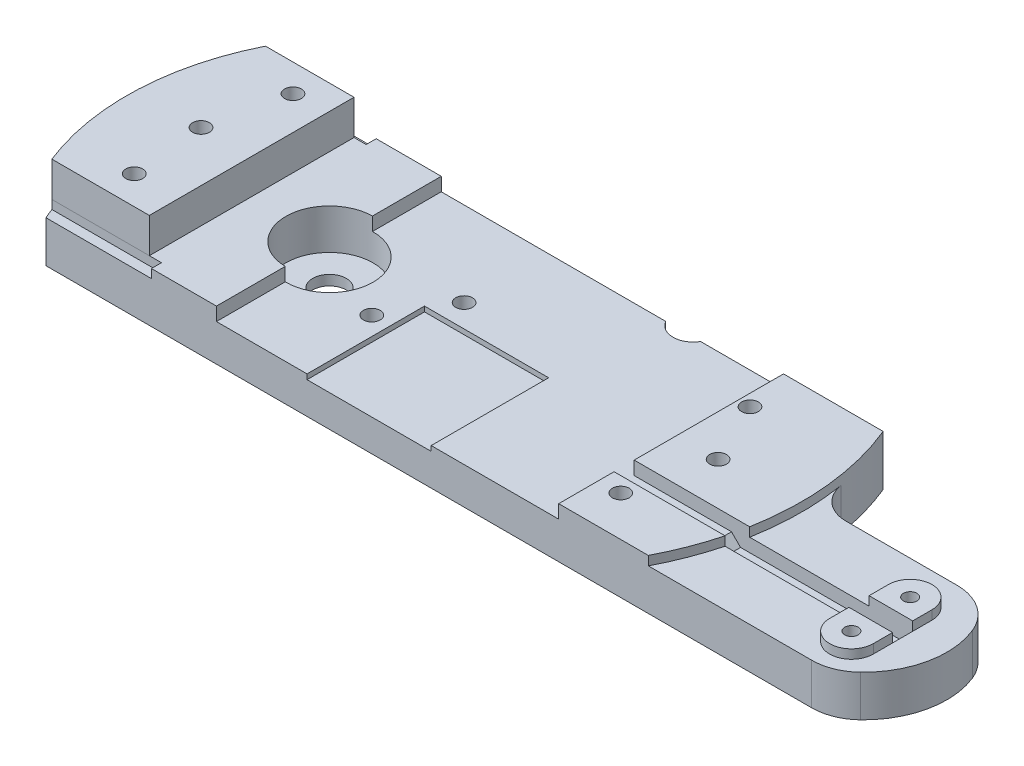
from build123d import *

# Parameters (mm, degrees)
SKETCH1_W           = 195
SKETCH1_H           = 67
BOSS_EXTRUDE1_DEPTH = 25.4
CUT_EXTRUDE1_DEPTH  = 107.177492907
CUT_EXTRUDE2_DEPTH  = 121.997561959
CUT_EXTRUDE3_START  = -13
SKETCH4_W           = 3.612655346
SKETCH4_H           = 3
CUT_EXTRUDE3_DEPTH  = 13
SKETCH6_R           = 2.5
CUT_EXTRUDE4_DEPTH  = 107.177492907
SKETCH7_W           = 37
SKETCH7_H           = 35
CUT_EXTRUDE5_DEPTH  = 1.5
CUT_EXTRUDE6_DEPTH  = 18.5
SKETCH9_R           = 2
BOSS_EXTRUDE2_DEPTH = 12.3
FILLET1_R           = 10
CUT_EXTRUDE7_REACH  = 165.895
CUT_EXTRUDE7_START  = -3
SKETCH10_R          = 13
SKETCH13_R          = 5
CUT_EXTRUDE9_DEPTH  = 161.89488962
SKETCH11_R          = 2
BOSS_EXTRUDE3_DEPTH = 2.7
CUT_EXTRUDE8_DEPTH  = 6


# Read off the part's stored shape, not the designer's step: Split1
with BuildPart() as part:
    # Sketch1 → Boss-Extrude1 (new body)
    with BuildSketch(Plane(origin=(0, 0, 0), x_dir=(1, 0, 0), z_dir=(0, 1, 0))):
        Rectangle(SKETCH1_W, SKETCH1_H)
    extrude(amount=BOSS_EXTRUDE1_DEPTH)

    # Sketch2 → Cut-Extrude1 (cut, through all)
    with BuildSketch(Plane.XZ):
        with BuildLine():
            Line((97.5, -3.219751644), (97.5, 33.5))
            Line((97.5, 33.5), (88.5, 33.5))
            ThreePointArc((88.5, 33.5), (95.217186872, 15.683556008), (97.5, -3.219751644))
        make_face()
        with BuildLine():
            Line((97.5, -33.5), (97.5, -3.219751644))
            ThreePointArc((97.5, -3.219751644), (95.985558513, -18.65423771), (91.5, -33.5))
            Line((91.5, -33.5), (97.5, -33.5))
        make_face()
        with BuildLine():
            ThreePointArc((-88, -33.5), (-95.08607052, -15.861694529), (-97.5, 2.992884749))
            Line((-97.5, 2.992884749), (-97.5, -33.5))
            Line((-97.5, -33.5), (-88, -33.5))
        make_face()
        with BuildLine():
            ThreePointArc((-97.5, 2.992884749), (-95.856964648, 18.588830376), (-91, 33.5))
            Line((-91, 33.5), (-97.5, 33.5))
            Line((-97.5, 33.5), (-97.5, 2.992884749))
        make_face()
    extrude(amount=-CUT_EXTRUDE1_DEPTH, mode=Mode.SUBTRACT)

    # Sketch3 → Cut-Extrude2 (cut, through all)
    with BuildSketch(Plane(origin=(0, 0, 33.5), x_dir=(-1, 0, 0), z_dir=(0, 0, -1))):
        Polygon((63.2, 25.4), (63.2, 15), (40.2, 15), (40.2, 11), (-61.8, 11), (-61.8, 15), (-97.5, 15), (-97.5, 25.4), align=None)
    extrude(amount=CUT_EXTRUDE2_DEPTH, mode=Mode.SUBTRACT)

    # Sketch4 → Cut-Extrude3 (cut)
    with BuildSketch(Plane(origin=(0, 25.4, 0), x_dir=(1, 0, 0), z_dir=(0, 1, 0)).offset(CUT_EXTRUDE3_START)):
        with BuildLine():
            Line((-63.2, 30.5), (-63.2, 33.5))
            Line((-63.2, 33.5), (-88, 33.5))
            ThreePointArc((-88, 33.5), (-88.810680862, 32.008999469), (-89.587344654, 30.5))
            Line((-89.587344654, 30.5), (-63.2, 30.5))
        make_face()
        with Locations((-61.393672327, 32)):
            Rectangle(SKETCH4_W, SKETCH4_H)
        with BuildLine():
            Line((-63.2, -33.5), (-63.2, -30.5))
            Line((-63.2, -30.5), (-92.261692194, -30.5))
            ThreePointArc((-92.261692194, -30.5), (-91.647155152, -32.006859002), (-91, -33.5))
            Line((-91, -33.5), (-63.2, -33.5))
        make_face()
        with Locations((-61.393672327, -32)):
            Rectangle(SKETCH4_W, SKETCH4_H)
    extrude(amount=CUT_EXTRUDE3_DEPTH, mode=Mode.SUBTRACT)

    # Sketch6 → Cut-Extrude4 (cut, through all)
    with BuildSketch(Plane.XZ):
        with Locations(Location((-18.7, 8.7, 0), (0, 0, 270))):
            Circle(SKETCH6_R)
        with Locations(Location((74.1, -1.7, 0), (0, 0, 270))):
            Circle(SKETCH6_R)
        with Locations(Location((68.3, 21.5, 0), (0, 0, 270))):
            Circle(SKETCH6_R)
        with Locations(Location((65.3, -20, 0), (0, 0, 270))):
            Circle(SKETCH6_R)
        with Locations(Location((-8.2, -8.3, 0), (0, 0, 270))):
            Circle(SKETCH6_R)
        with Locations(Location((-76.2, 22, 0), (0, 0, 270))):
            Circle(SKETCH6_R)
        with Locations(Location((-78.2, 0.1, 0), (0, 0, 270))):
            Circle(SKETCH6_R)
        with Locations(Location((-73.2, -22.3, 0), (0, 0, 270))):
            Circle(SKETCH6_R)
    extrude(amount=-CUT_EXTRUDE4_DEPTH, mode=Mode.SUBTRACT)

    # Sketch7 → Cut-Extrude5 (cut)
    with BuildSketch(Plane(origin=(0, 11, 0), x_dir=(1, 0, 0), z_dir=(0, 1, 0))):
        with Locations((5.3, -16)):
            Rectangle(SKETCH7_W, SKETCH7_H)
    extrude(amount=-CUT_EXTRUDE5_DEPTH, mode=Mode.SUBTRACT)

    # Sketch8 → Cut-Extrude6 (cut)
    with BuildSketch(Plane(origin=(0, 25.4, 0), x_dir=(1, 0, 0), z_dir=(0, 1, 0))):
        with BuildLine():
            Line((37.096152423, 33.5), (31.9, 33.5))
            Line((31.9, 33.5), (31.9, 30.5))
            ThreePointArc((31.9, 30.5), (34.9, 31.303847577), (37.096152423, 33.5))
        make_face()
        with BuildLine():
            Line((31.9, 33.5), (26.703847577, 33.5))
            ThreePointArc((26.703847577, 33.5), (28.9, 31.303847577), (31.9, 30.5))
            Line((31.9, 30.5), (31.9, 33.5))
        make_face()
    extrude(amount=-CUT_EXTRUDE6_DEPTH, mode=Mode.SUBTRACT)

    # Sketch9 → Boss-Extrude2 (add)
    with BuildSketch(Plane.XZ):
        with BuildLine():
            Line((88.5, 33.5), (137.200361796, 33.5))
            ThreePointArc((137.200361796, 33.5), (142.769729546, 32.427747228), (147.542861296, 29.364285714))
            ThreePointArc((147.542861296, 29.364285714), (154.743476693, 16.527679502), (153.473750823, 1.864285714))
            ThreePointArc((153.473750823, 1.864285714), (147.953179578, -4.940573023), (139.572717606, -7.5))
            Line((139.572717606, -7.5), (97.384558849, -7.5))
            ThreePointArc((97.384558849, -7.5), (95.698800641, 13.597328658), (88.5, 33.5))
        make_face()
        with Locations(Location((138.3, 5.25, 0), (0, 0, 270))):
            Circle(SKETCH9_R, mode=Mode.SUBTRACT)
        with Locations(Location((138.3, 22.75, 0), (0, 0, 270))):
            Circle(SKETCH9_R, mode=Mode.SUBTRACT)
    extrude(amount=-BOSS_EXTRUDE2_DEPTH)

    # Fillet1
    fillet1_edges = [part.edges().sort_by_distance(p)[0] for p in [
        (97.384558849, 6.15, -7.5),
    ]]
    fillet(fillet1_edges, radius=FILLET1_R)

    # Cut-Extrude7: up to this face of the body (flat: up to its plane)
    cut_extrude7_end = Plane(part.part.faces().sort_by_distance((-51.561702064, 15, 0))[0])
    # Sketch10 → Cut-Extrude7 (cut, up to the picked face)
    with BuildSketch(Plane.XZ.offset(CUT_EXTRUDE7_START), mode=Mode.PRIVATE) as cut_extrude7_sk1:
        with Locations(Location((-40.017782272, 0, 0), (0, 0, 270))):
            Circle(SKETCH10_R)
    cut_extrude7_tool1 = split(extrude(cut_extrude7_sk1.sketch, amount=-CUT_EXTRUDE7_REACH, mode=Mode.PRIVATE), bisect_by=cut_extrude7_end, keep=Keep.BOTH, mode=Mode.PRIVATE)
    add(cut_extrude7_tool1.solids().sort_by(Axis((-40.017782, 3, 0), (0, 1, 0)))[0], mode=Mode.SUBTRACT)

    # Sketch13 → Cut-Extrude9 (cut, through all)
    with BuildSketch(Plane.XZ):
        with Locations(Location((-40.017782272, 0, 0), (0, 0, 270))):
            Circle(SKETCH13_R)
    extrude(amount=-CUT_EXTRUDE9_DEPTH, mode=Mode.SUBTRACT)

    # Sketch11 → Boss-Extrude3 (add)
    # profile 1 of 2: a face of its own
    with BuildSketch(Plane(origin=(0, 12.3, 0), x_dir=(1, 0, 0), z_dir=(0, 1, 0))):
        with BuildLine():
            Line((144.8, -11), (144.8, -5.25))
            ThreePointArc((144.8, -5.25), (138.3, 1.25), (131.8, -5.25))
            Line((131.8, -5.25), (131.8, -11))
            Line((131.8, -11), (144.8, -11))
        make_face()
        with Locations(Location((138.3, -5.25, 0), (0, 0, 90))):
            Circle(SKETCH11_R, mode=Mode.SUBTRACT)
    # profile 2 of 2: a face of its own
    with BuildSketch(Plane(origin=(0, 12.3, 0), x_dir=(1, 0, 0), z_dir=(0, 1, 0))):
        with BuildLine():
            Line((144.8, -22.75), (144.8, -17))
            Line((144.8, -17), (131.8, -17))
            Line((131.8, -17), (131.8, -22.75))
            ThreePointArc((131.8, -22.75), (138.3, -29.25), (144.8, -22.75))
        make_face()
        with Locations(Location((138.3, -22.75, 0), (0, 0, 90))):
            Circle(SKETCH11_R, mode=Mode.SUBTRACT)
    extrude(amount=BOSS_EXTRUDE3_DEPTH)


with BuildPart() as body_2:
    # Split1: the piece on the far side of the plane
    add(part.part)
    split(bisect_by=Plane(origin=(0, 15, 0), x_dir=(1, 0, 0), z_dir=(0, 1, 0)), keep=Keep.BOTTOM)

    # Sketch12 → Cut-Extrude8 (cut)
    with BuildSketch(Plane.XY.offset(11)):
        Polygon((144.8, 15), (144.8, 8.3), (93.5, 8.3), (90.8, 11), (61.8, 11), (61.8, 15), align=None)
    extrude(amount=CUT_EXTRUDE8_DEPTH, mode=Mode.SUBTRACT)


with BuildPart() as part_1:
    add(part.part)

    # Split1
    split(bisect_by=Plane(origin=(0, 15, 0), x_dir=(1, 0, 0), z_dir=(0, 1, 0)), keep=Keep.TOP)


solid = Compound([body_2.part, part_1.part])
